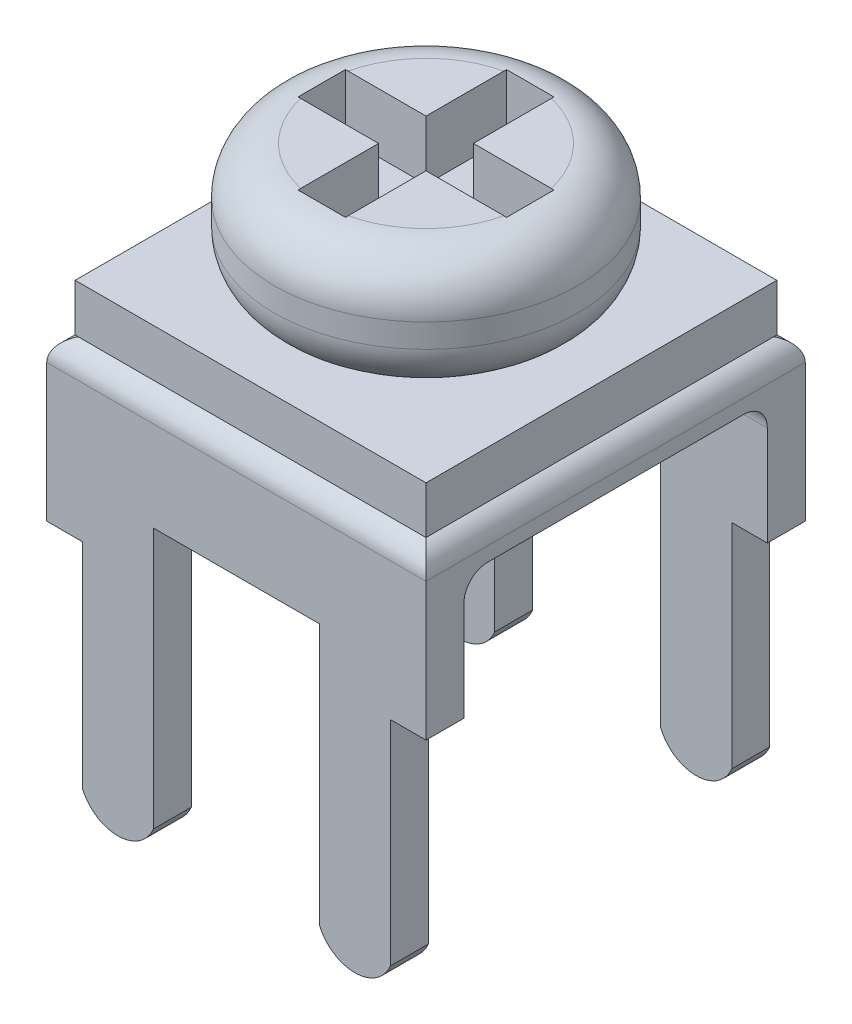
from build123d import *

# Parameters (mm, degrees)
BOSS_EXTRUDE1_DEPTH     = 4
CUT_EXTRUDE1_DEPTH      = 8.549834435
CUT_EXTRUDE1_DEPTH_BACK = 8.549834435
FILLET1_R               = 0.5
SKETCH4_R               = 1.5
BOSS_EXTRUDE2_DEPTH     = 1
SKETCH5_R               = 3.2
BOSS_EXTRUDE3_DEPTH     = 2.5
FILLET2_R               = 1
SKETCH6_W               = 1
SKETCH6_H               = 4.4
SKETCH6_W_2             = 4.4
SKETCH6_H_2             = 1
CUT_EXTRUDE_THIN1_DEPTH = 1.25
SKETCH8_W               = 7.4
SKETCH8_H               = 7.4
BOSS_EXTRUDE4_DEPTH     = 1


with BuildPart() as part:
    # Sketch1 → Boss-Extrude1 (new, symmetric)
    with BuildSketch(Plane.XY):
        with BuildLine():
            Line((-1.75, 1), (-1.75, -4.5))
            ThreePointArc((-1.75, -4.5), (-2.5, -5), (-3.25, -4.5))
            Line((-3.25, -4.5), (-3.25, 0))
            Line((-3.25, 0), (-4, 0))
            Line((-4, 0), (-4, 2.9))
            ThreePointArc((-4, 2.9), (-3.853553391, 3.253553391), (-3.5, 3.4))
            Line((-3.5, 3.4), (3.5, 3.4))
            ThreePointArc((3.5, 3.4), (3.853553391, 3.253553391), (4, 2.9))
            Line((4, 2.9), (4, 0))
            Line((4, 0), (3.25, 0))
            Line((3.25, 0), (3.25, -4.5))
            ThreePointArc((3.25, -4.5), (2.5, -5), (1.75, -4.5))
            Line((1.75, -4.5), (1.75, 1))
            Line((1.75, 1), (-1.75, 1))
        make_face()
    extrude(amount=BOSS_EXTRUDE1_DEPTH, both=True)

    # Sketch3 → Cut-Extrude1 (cut, two sides: drawn at the far end of the back side and taken through both)
    with BuildSketch(Plane(origin=(0, 0, 0), x_dir=(0, 0, -1), z_dir=(1, 0, 0)).offset(-CUT_EXTRUDE1_DEPTH_BACK)):
        with BuildLine():
            Line((-3.2, -5), (-3.2, 2.1))
            ThreePointArc((-3.2, 2.1), (-3.053553391, 2.453553391), (-2.7, 2.6))
            Line((-2.7, 2.6), (2.7, 2.6))
            ThreePointArc((2.7, 2.6), (3.053553391, 2.453553391), (3.2, 2.1))
            Line((3.2, 2.1), (3.2, -5))
            Line((3.2, -5), (-3.2, -5))
        make_face()
    extrude(amount=CUT_EXTRUDE1_DEPTH + CUT_EXTRUDE1_DEPTH_BACK, mode=Mode.SUBTRACT)

    # Fillet1
    # the kernel refuses this fillet: 0.5 mm, written as the material it takes off along each edge
    with BuildSketch(Plane(origin=(-4.75, 3.4, -4), x_dir=(0, -1, 0), z_dir=(1, 0, 0))) as fillet1_piece_1:
        with BuildLine():
            CenterArc((FILLET1_R, -FILLET1_R), FILLET1_R, 90, 90)
            Line((0, -FILLET1_R), (0, 0))
            Line((0, 0), (FILLET1_R, 0))
        make_face()
    extrude(amount=9.5, mode=Mode.SUBTRACT)
    with BuildSketch(Plane(origin=(-4.75, 3.4, 4), x_dir=(0, -1, 0), z_dir=(1, 0, 0))) as fillet1_piece_2:
        with BuildLine():
            CenterArc((FILLET1_R, FILLET1_R), FILLET1_R, 180, 90)
            Line((0, FILLET1_R), (0, 0))
            Line((0, 0), (FILLET1_R, 0))
        make_face()
    extrude(amount=9.5, mode=Mode.SUBTRACT)

    # Sketch4 → Boss-Extrude2 (add)
    with BuildSketch(Plane(origin=(0, 3.4, 0), x_dir=(1, 0, 0), z_dir=(0, 1, 0))):
        with Locations(Location((0, 0, 0), (0, 0, 90))):
            Circle(SKETCH4_R)
    extrude(amount=BOSS_EXTRUDE2_DEPTH)

    # Sketch5 → Boss-Extrude3 (add)
    with BuildSketch(Plane(origin=(0, 4.4, 0), x_dir=(1, 0, 0), z_dir=(0, 1, 0))):
        with Locations(Location((0, 0, 0), (0, 0, 270))):
            Circle(SKETCH5_R)
    extrude(amount=BOSS_EXTRUDE3_DEPTH)

    # Fillet2
    fillet2_edges = [part.edges().sort_by_distance(p)[0] for p in [
        (0, 4.4, -3.2),
        (0, 6.9, -3.2),
    ]]
    fillet(fillet2_edges, radius=FILLET2_R)

    # Sketch6 → Cut-Extrude-Thin1 (cut)
    with BuildSketch(Plane(origin=(0, 6.9, 0), x_dir=(1, 0, 0), z_dir=(0, 1, 0))):
        Rectangle(SKETCH6_W, SKETCH6_H)
        Rectangle(SKETCH6_W_2, SKETCH6_H_2)
    extrude(amount=-CUT_EXTRUDE_THIN1_DEPTH, mode=Mode.SUBTRACT)

    # Sketch8 → Boss-Extrude4 (add)
    with BuildSketch(Plane(origin=(0, 3.4, 0), x_dir=(1, 0, 0), z_dir=(0, 1, 0))):
        Rectangle(SKETCH8_W, SKETCH8_H)
    extrude(amount=BOSS_EXTRUDE4_DEPTH)


solid = part.part
